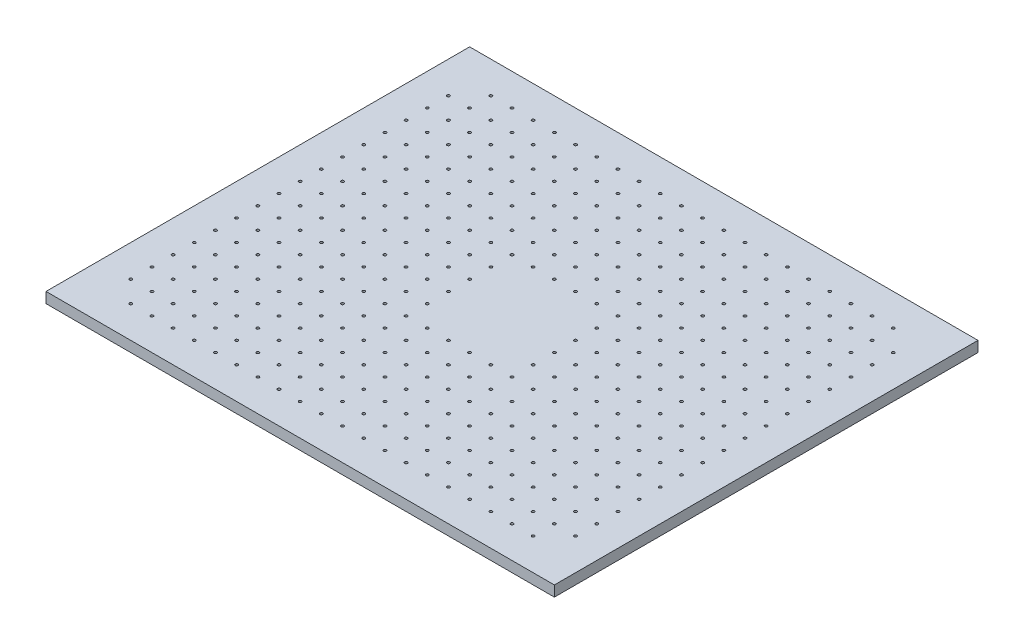
from build123d import *

# Parameters (mm, degrees)
CROQUIS_TABLERO_W                   = 1200
CROQUIS_TABLERO_H                   = 1000
TABLERO_1200X1000X25_DEPTH          = 25
REJILLA_AGUJEROS_M6_D6_6_DEPTH      = 782.424980404
REJILLA_AGUJEROS_M6_D6_6_DEPTH_BACK = 782.424980404
CROQUIS_REJILLA_M6_PASO50_R         = 3.3


with BuildPart() as part:
    # Croquis_tablero → Tablero_1200x1000x25 (new body)
    with BuildSketch(Plane(origin=(0, 0, 0), x_dir=(1, 0, 0), z_dir=(0, 1, 0))):
        Rectangle(CROQUIS_TABLERO_W, CROQUIS_TABLERO_H)
    extrude(amount=-TABLERO_1200X1000X25_DEPTH)

    # Croquis_rejilla_M6_paso50 → Rejilla_agujeros_M6_D6.6 (cut, two sides: drawn at the far end of the back side and taken through both)
    with BuildSketch(Plane(origin=(0, 0, 0), x_dir=(1, 0, 0), z_dir=(0, 1, 0)).offset(-REJILLA_AGUJEROS_M6_D6_6_DEPTH_BACK)):
        with Locations(Location((-525, -375, 0), (0, 0, 270))):
            Circle(CROQUIS_REJILLA_M6_PASO50_R)
        with Locations(Location((-525, -325, 0), (0, 0, 270))):
            Circle(CROQUIS_REJILLA_M6_PASO50_R)
        with Locations(Location((-525, -275, 0), (0, 0, 270))):
            Circle(CROQUIS_REJILLA_M6_PASO50_R)
        with Locations(Location((-525, -225, 0), (0, 0, 270))):
            Circle(CROQUIS_REJILLA_M6_PASO50_R)
        with Locations(Location((-525, -175, 0), (0, 0, 270))):
            Circle(CROQUIS_REJILLA_M6_PASO50_R)
        with Locations(Location((-525, -125, 0), (0, 0, 270))):
            Circle(CROQUIS_REJILLA_M6_PASO50_R)
        with Locations(Location((-525, -75, 0), (0, 0, 270))):
            Circle(CROQUIS_REJILLA_M6_PASO50_R)
        with Locations(Location((-525, -25, 0), (0, 0, 270))):
            Circle(CROQUIS_REJILLA_M6_PASO50_R)
        with Locations(Location((-525, 25, 0), (0, 0, 270))):
            Circle(CROQUIS_REJILLA_M6_PASO50_R)
        with Locations(Location((-525, 75, 0), (0, 0, 270))):
            Circle(CROQUIS_REJILLA_M6_PASO50_R)
        with Locations(Location((-525, 125, 0), (0, 0, 270))):
            Circle(CROQUIS_REJILLA_M6_PASO50_R)
        with Locations(Location((-525, 175, 0), (0, 0, 270))):
            Circle(CROQUIS_REJILLA_M6_PASO50_R)
        with Locations(Location((-525, 225, 0), (0, 0, 270))):
            Circle(CROQUIS_REJILLA_M6_PASO50_R)
        with Locations(Location((-525, 275, 0), (0, 0, 270))):
            Circle(CROQUIS_REJILLA_M6_PASO50_R)
        with Locations(Location((-525, 325, 0), (0, 0, 270))):
            Circle(CROQUIS_REJILLA_M6_PASO50_R)
        with Locations(Location((-525, 375, 0), (0, 0, 270))):
            Circle(CROQUIS_REJILLA_M6_PASO50_R)
        with Locations(Location((-475, -425, 0), (0, 0, 270))):
            Circle(CROQUIS_REJILLA_M6_PASO50_R)
        with Locations(Location((-475, -375, 0), (0, 0, 270))):
            Circle(CROQUIS_REJILLA_M6_PASO50_R)
        with Locations(Location((-475, -325, 0), (0, 0, 270))):
            Circle(CROQUIS_REJILLA_M6_PASO50_R)
        with Locations(Location((-475, -275, 0), (0, 0, 270))):
            Circle(CROQUIS_REJILLA_M6_PASO50_R)
        with Locations(Location((-475, -225, 0), (0, 0, 270))):
            Circle(CROQUIS_REJILLA_M6_PASO50_R)
        with Locations(Location((-475, -175, 0), (0, 0, 270))):
            Circle(CROQUIS_REJILLA_M6_PASO50_R)
        with Locations(Location((-475, -125, 0), (0, 0, 270))):
            Circle(CROQUIS_REJILLA_M6_PASO50_R)
        with Locations(Location((-475, -75, 0), (0, 0, 270))):
            Circle(CROQUIS_REJILLA_M6_PASO50_R)
        with Locations(Location((-475, -25, 0), (0, 0, 270))):
            Circle(CROQUIS_REJILLA_M6_PASO50_R)
        with Locations(Location((-475, 25, 0), (0, 0, 270))):
            Circle(CROQUIS_REJILLA_M6_PASO50_R)
        with Locations(Location((-475, 75, 0), (0, 0, 270))):
            Circle(CROQUIS_REJILLA_M6_PASO50_R)
        with Locations(Location((-475, 125, 0), (0, 0, 270))):
            Circle(CROQUIS_REJILLA_M6_PASO50_R)
        with Locations(Location((-475, 175, 0), (0, 0, 270))):
            Circle(CROQUIS_REJILLA_M6_PASO50_R)
        with Locations(Location((-475, 225, 0), (0, 0, 270))):
            Circle(CROQUIS_REJILLA_M6_PASO50_R)
        with Locations(Location((-475, 275, 0), (0, 0, 270))):
            Circle(CROQUIS_REJILLA_M6_PASO50_R)
        with Locations(Location((-475, 325, 0), (0, 0, 270))):
            Circle(CROQUIS_REJILLA_M6_PASO50_R)
        with Locations(Location((-475, 375, 0), (0, 0, 270))):
            Circle(CROQUIS_REJILLA_M6_PASO50_R)
        with Locations(Location((-475, 425, 0), (0, 0, 270))):
            Circle(CROQUIS_REJILLA_M6_PASO50_R)
        with Locations(Location((-425, -425, 0), (0, 0, 270))):
            Circle(CROQUIS_REJILLA_M6_PASO50_R)
        with Locations(Location((-425, -375, 0), (0, 0, 270))):
            Circle(CROQUIS_REJILLA_M6_PASO50_R)
        with Locations(Location((-425, -325, 0), (0, 0, 270))):
            Circle(CROQUIS_REJILLA_M6_PASO50_R)
        with Locations(Location((-425, -275, 0), (0, 0, 270))):
            Circle(CROQUIS_REJILLA_M6_PASO50_R)
        with Locations(Location((-425, -225, 0), (0, 0, 270))):
            Circle(CROQUIS_REJILLA_M6_PASO50_R)
        with Locations(Location((-425, -175, 0), (0, 0, 270))):
            Circle(CROQUIS_REJILLA_M6_PASO50_R)
        with Locations(Location((-425, -125, 0), (0, 0, 270))):
            Circle(CROQUIS_REJILLA_M6_PASO50_R)
        with Locations(Location((-425, -75, 0), (0, 0, 270))):
            Circle(CROQUIS_REJILLA_M6_PASO50_R)
        with Locations(Location((-425, -25, 0), (0, 0, 270))):
            Circle(CROQUIS_REJILLA_M6_PASO50_R)
        with Locations(Location((-425, 25, 0), (0, 0, 270))):
            Circle(CROQUIS_REJILLA_M6_PASO50_R)
        with Locations(Location((-425, 75, 0), (0, 0, 270))):
            Circle(CROQUIS_REJILLA_M6_PASO50_R)
        with Locations(Location((-425, 125, 0), (0, 0, 270))):
            Circle(CROQUIS_REJILLA_M6_PASO50_R)
        with Locations(Location((-425, 175, 0), (0, 0, 270))):
            Circle(CROQUIS_REJILLA_M6_PASO50_R)
        with Locations(Location((-425, 225, 0), (0, 0, 270))):
            Circle(CROQUIS_REJILLA_M6_PASO50_R)
        with Locations(Location((-425, 275, 0), (0, 0, 270))):
            Circle(CROQUIS_REJILLA_M6_PASO50_R)
        with Locations(Location((-425, 325, 0), (0, 0, 270))):
            Circle(CROQUIS_REJILLA_M6_PASO50_R)
        with Locations(Location((-425, 375, 0), (0, 0, 270))):
            Circle(CROQUIS_REJILLA_M6_PASO50_R)
        with Locations(Location((-425, 425, 0), (0, 0, 270))):
            Circle(CROQUIS_REJILLA_M6_PASO50_R)
        with Locations(Location((-375, -425, 0), (0, 0, 270))):
            Circle(CROQUIS_REJILLA_M6_PASO50_R)
        with Locations(Location((-375, -375, 0), (0, 0, 270))):
            Circle(CROQUIS_REJILLA_M6_PASO50_R)
        with Locations(Location((-375, -325, 0), (0, 0, 270))):
            Circle(CROQUIS_REJILLA_M6_PASO50_R)
        with Locations(Location((-375, -275, 0), (0, 0, 270))):
            Circle(CROQUIS_REJILLA_M6_PASO50_R)
        with Locations(Location((-375, -225, 0), (0, 0, 270))):
            Circle(CROQUIS_REJILLA_M6_PASO50_R)
        with Locations(Location((-375, -175, 0), (0, 0, 270))):
            Circle(CROQUIS_REJILLA_M6_PASO50_R)
        with Locations(Location((-375, -125, 0), (0, 0, 270))):
            Circle(CROQUIS_REJILLA_M6_PASO50_R)
        with Locations(Location((-375, -75, 0), (0, 0, 270))):
            Circle(CROQUIS_REJILLA_M6_PASO50_R)
        with Locations(Location((-375, -25, 0), (0, 0, 270))):
            Circle(CROQUIS_REJILLA_M6_PASO50_R)
        with Locations(Location((-375, 25, 0), (0, 0, 270))):
            Circle(CROQUIS_REJILLA_M6_PASO50_R)
        with Locations(Location((-375, 75, 0), (0, 0, 270))):
            Circle(CROQUIS_REJILLA_M6_PASO50_R)
        with Locations(Location((-375, 125, 0), (0, 0, 270))):
            Circle(CROQUIS_REJILLA_M6_PASO50_R)
        with Locations(Location((-375, 175, 0), (0, 0, 270))):
            Circle(CROQUIS_REJILLA_M6_PASO50_R)
        with Locations(Location((-375, 225, 0), (0, 0, 270))):
            Circle(CROQUIS_REJILLA_M6_PASO50_R)
        with Locations(Location((-375, 275, 0), (0, 0, 270))):
            Circle(CROQUIS_REJILLA_M6_PASO50_R)
        with Locations(Location((-375, 325, 0), (0, 0, 270))):
            Circle(CROQUIS_REJILLA_M6_PASO50_R)
        with Locations(Location((-375, 375, 0), (0, 0, 270))):
            Circle(CROQUIS_REJILLA_M6_PASO50_R)
        with Locations(Location((-375, 425, 0), (0, 0, 270))):
            Circle(CROQUIS_REJILLA_M6_PASO50_R)
        with Locations(Location((-325, -425, 0), (0, 0, 270))):
            Circle(CROQUIS_REJILLA_M6_PASO50_R)
        with Locations(Location((-325, -375, 0), (0, 0, 270))):
            Circle(CROQUIS_REJILLA_M6_PASO50_R)
        with Locations(Location((-325, -325, 0), (0, 0, 270))):
            Circle(CROQUIS_REJILLA_M6_PASO50_R)
        with Locations(Location((-325, -275, 0), (0, 0, 270))):
            Circle(CROQUIS_REJILLA_M6_PASO50_R)
        with Locations(Location((-325, -225, 0), (0, 0, 270))):
            Circle(CROQUIS_REJILLA_M6_PASO50_R)
        with Locations(Location((-325, -175, 0), (0, 0, 270))):
            Circle(CROQUIS_REJILLA_M6_PASO50_R)
        with Locations(Location((-325, -125, 0), (0, 0, 270))):
            Circle(CROQUIS_REJILLA_M6_PASO50_R)
        with Locations(Location((-325, -75, 0), (0, 0, 270))):
            Circle(CROQUIS_REJILLA_M6_PASO50_R)
        with Locations(Location((-325, -25, 0), (0, 0, 270))):
            Circle(CROQUIS_REJILLA_M6_PASO50_R)
        with Locations(Location((-325, 25, 0), (0, 0, 270))):
            Circle(CROQUIS_REJILLA_M6_PASO50_R)
        with Locations(Location((-325, 75, 0), (0, 0, 270))):
            Circle(CROQUIS_REJILLA_M6_PASO50_R)
        with Locations(Location((-325, 125, 0), (0, 0, 270))):
            Circle(CROQUIS_REJILLA_M6_PASO50_R)
        with Locations(Location((-325, 175, 0), (0, 0, 270))):
            Circle(CROQUIS_REJILLA_M6_PASO50_R)
        with Locations(Location((-325, 225, 0), (0, 0, 270))):
            Circle(CROQUIS_REJILLA_M6_PASO50_R)
        with Locations(Location((-325, 275, 0), (0, 0, 270))):
            Circle(CROQUIS_REJILLA_M6_PASO50_R)
        with Locations(Location((-325, 325, 0), (0, 0, 270))):
            Circle(CROQUIS_REJILLA_M6_PASO50_R)
        with Locations(Location((-325, 375, 0), (0, 0, 270))):
            Circle(CROQUIS_REJILLA_M6_PASO50_R)
        with Locations(Location((-325, 425, 0), (0, 0, 270))):
            Circle(CROQUIS_REJILLA_M6_PASO50_R)
        with Locations(Location((-275, -425, 0), (0, 0, 270))):
            Circle(CROQUIS_REJILLA_M6_PASO50_R)
        with Locations(Location((-275, -375, 0), (0, 0, 270))):
            Circle(CROQUIS_REJILLA_M6_PASO50_R)
        with Locations(Location((-275, -325, 0), (0, 0, 270))):
            Circle(CROQUIS_REJILLA_M6_PASO50_R)
        with Locations(Location((-275, -275, 0), (0, 0, 270))):
            Circle(CROQUIS_REJILLA_M6_PASO50_R)
        with Locations(Location((-275, -225, 0), (0, 0, 270))):
            Circle(CROQUIS_REJILLA_M6_PASO50_R)
        with Locations(Location((-275, -175, 0), (0, 0, 270))):
            Circle(CROQUIS_REJILLA_M6_PASO50_R)
        with Locations(Location((-275, -125, 0), (0, 0, 270))):
            Circle(CROQUIS_REJILLA_M6_PASO50_R)
        with Locations(Location((-275, -75, 0), (0, 0, 270))):
            Circle(CROQUIS_REJILLA_M6_PASO50_R)
        with Locations(Location((-275, -25, 0), (0, 0, 270))):
            Circle(CROQUIS_REJILLA_M6_PASO50_R)
        with Locations(Location((-275, 25, 0), (0, 0, 270))):
            Circle(CROQUIS_REJILLA_M6_PASO50_R)
        with Locations(Location((-275, 75, 0), (0, 0, 270))):
            Circle(CROQUIS_REJILLA_M6_PASO50_R)
        with Locations(Location((-275, 125, 0), (0, 0, 270))):
            Circle(CROQUIS_REJILLA_M6_PASO50_R)
        with Locations(Location((-275, 175, 0), (0, 0, 270))):
            Circle(CROQUIS_REJILLA_M6_PASO50_R)
        with Locations(Location((-275, 225, 0), (0, 0, 270))):
            Circle(CROQUIS_REJILLA_M6_PASO50_R)
        with Locations(Location((-275, 275, 0), (0, 0, 270))):
            Circle(CROQUIS_REJILLA_M6_PASO50_R)
        with Locations(Location((-275, 325, 0), (0, 0, 270))):
            Circle(CROQUIS_REJILLA_M6_PASO50_R)
        with Locations(Location((-275, 375, 0), (0, 0, 270))):
            Circle(CROQUIS_REJILLA_M6_PASO50_R)
        with Locations(Location((-275, 425, 0), (0, 0, 270))):
            Circle(CROQUIS_REJILLA_M6_PASO50_R)
        with Locations(Location((-225, -425, 0), (0, 0, 270))):
            Circle(CROQUIS_REJILLA_M6_PASO50_R)
        with Locations(Location((-225, -375, 0), (0, 0, 270))):
            Circle(CROQUIS_REJILLA_M6_PASO50_R)
        with Locations(Location((-225, -325, 0), (0, 0, 270))):
            Circle(CROQUIS_REJILLA_M6_PASO50_R)
        with Locations(Location((-225, -275, 0), (0, 0, 270))):
            Circle(CROQUIS_REJILLA_M6_PASO50_R)
        with Locations(Location((-225, -225, 0), (0, 0, 270))):
            Circle(CROQUIS_REJILLA_M6_PASO50_R)
        with Locations(Location((-225, -175, 0), (0, 0, 270))):
            Circle(CROQUIS_REJILLA_M6_PASO50_R)
        with Locations(Location((-225, -125, 0), (0, 0, 270))):
            Circle(CROQUIS_REJILLA_M6_PASO50_R)
        with Locations(Location((-225, -75, 0), (0, 0, 270))):
            Circle(CROQUIS_REJILLA_M6_PASO50_R)
        with Locations(Location((-225, -25, 0), (0, 0, 270))):
            Circle(CROQUIS_REJILLA_M6_PASO50_R)
        with Locations(Location((-225, 25, 0), (0, 0, 270))):
            Circle(CROQUIS_REJILLA_M6_PASO50_R)
        with Locations(Location((-225, 75, 0), (0, 0, 270))):
            Circle(CROQUIS_REJILLA_M6_PASO50_R)
        with Locations(Location((-225, 125, 0), (0, 0, 270))):
            Circle(CROQUIS_REJILLA_M6_PASO50_R)
        with Locations(Location((-225, 175, 0), (0, 0, 270))):
            Circle(CROQUIS_REJILLA_M6_PASO50_R)
        with Locations(Location((-225, 225, 0), (0, 0, 270))):
            Circle(CROQUIS_REJILLA_M6_PASO50_R)
        with Locations(Location((-225, 275, 0), (0, 0, 270))):
            Circle(CROQUIS_REJILLA_M6_PASO50_R)
        with Locations(Location((-225, 325, 0), (0, 0, 270))):
            Circle(CROQUIS_REJILLA_M6_PASO50_R)
        with Locations(Location((-225, 375, 0), (0, 0, 270))):
            Circle(CROQUIS_REJILLA_M6_PASO50_R)
        with Locations(Location((-225, 425, 0), (0, 0, 270))):
            Circle(CROQUIS_REJILLA_M6_PASO50_R)
        with Locations(Location((-175, -425, 0), (0, 0, 270))):
            Circle(CROQUIS_REJILLA_M6_PASO50_R)
        with Locations(Location((-175, -375, 0), (0, 0, 270))):
            Circle(CROQUIS_REJILLA_M6_PASO50_R)
        with Locations(Location((-175, -325, 0), (0, 0, 270))):
            Circle(CROQUIS_REJILLA_M6_PASO50_R)
        with Locations(Location((-175, -275, 0), (0, 0, 270))):
            Circle(CROQUIS_REJILLA_M6_PASO50_R)
        with Locations(Location((-175, -225, 0), (0, 0, 270))):
            Circle(CROQUIS_REJILLA_M6_PASO50_R)
        with Locations(Location((-175, -175, 0), (0, 0, 270))):
            Circle(CROQUIS_REJILLA_M6_PASO50_R)
        with Locations(Location((-175, -125, 0), (0, 0, 270))):
            Circle(CROQUIS_REJILLA_M6_PASO50_R)
        with Locations(Location((-175, -75, 0), (0, 0, 270))):
            Circle(CROQUIS_REJILLA_M6_PASO50_R)
        with Locations(Location((-175, -25, 0), (0, 0, 270))):
            Circle(CROQUIS_REJILLA_M6_PASO50_R)
        with Locations(Location((-175, 25, 0), (0, 0, 270))):
            Circle(CROQUIS_REJILLA_M6_PASO50_R)
        with Locations(Location((-175, 75, 0), (0, 0, 270))):
            Circle(CROQUIS_REJILLA_M6_PASO50_R)
        with Locations(Location((-175, 125, 0), (0, 0, 270))):
            Circle(CROQUIS_REJILLA_M6_PASO50_R)
        with Locations(Location((-175, 175, 0), (0, 0, 270))):
            Circle(CROQUIS_REJILLA_M6_PASO50_R)
        with Locations(Location((-175, 225, 0), (0, 0, 270))):
            Circle(CROQUIS_REJILLA_M6_PASO50_R)
        with Locations(Location((-175, 275, 0), (0, 0, 270))):
            Circle(CROQUIS_REJILLA_M6_PASO50_R)
        with Locations(Location((-175, 325, 0), (0, 0, 270))):
            Circle(CROQUIS_REJILLA_M6_PASO50_R)
        with Locations(Location((-175, 375, 0), (0, 0, 270))):
            Circle(CROQUIS_REJILLA_M6_PASO50_R)
        with Locations(Location((-175, 425, 0), (0, 0, 270))):
            Circle(CROQUIS_REJILLA_M6_PASO50_R)
        with Locations(Location((-125, -425, 0), (0, 0, 270))):
            Circle(CROQUIS_REJILLA_M6_PASO50_R)
        with Locations(Location((-125, -375, 0), (0, 0, 270))):
            Circle(CROQUIS_REJILLA_M6_PASO50_R)
        with Locations(Location((-125, -325, 0), (0, 0, 270))):
            Circle(CROQUIS_REJILLA_M6_PASO50_R)
        with Locations(Location((-125, -275, 0), (0, 0, 270))):
            Circle(CROQUIS_REJILLA_M6_PASO50_R)
        with Locations(Location((-125, -225, 0), (0, 0, 270))):
            Circle(CROQUIS_REJILLA_M6_PASO50_R)
        with Locations(Location((-125, -175, 0), (0, 0, 270))):
            Circle(CROQUIS_REJILLA_M6_PASO50_R)
        with Locations(Location((-125, -125, 0), (0, 0, 270))):
            Circle(CROQUIS_REJILLA_M6_PASO50_R)
        with Locations(Location((-125, -75, 0), (0, 0, 270))):
            Circle(CROQUIS_REJILLA_M6_PASO50_R)
        with Locations(Location((-125, -25, 0), (0, 0, 270))):
            Circle(CROQUIS_REJILLA_M6_PASO50_R)
        with Locations(Location((-125, 25, 0), (0, 0, 270))):
            Circle(CROQUIS_REJILLA_M6_PASO50_R)
        with Locations(Location((-125, 75, 0), (0, 0, 270))):
            Circle(CROQUIS_REJILLA_M6_PASO50_R)
        with Locations(Location((-125, 125, 0), (0, 0, 270))):
            Circle(CROQUIS_REJILLA_M6_PASO50_R)
        with Locations(Location((-125, 175, 0), (0, 0, 270))):
            Circle(CROQUIS_REJILLA_M6_PASO50_R)
        with Locations(Location((-125, 225, 0), (0, 0, 270))):
            Circle(CROQUIS_REJILLA_M6_PASO50_R)
        with Locations(Location((-125, 275, 0), (0, 0, 270))):
            Circle(CROQUIS_REJILLA_M6_PASO50_R)
        with Locations(Location((-125, 325, 0), (0, 0, 270))):
            Circle(CROQUIS_REJILLA_M6_PASO50_R)
        with Locations(Location((-125, 375, 0), (0, 0, 270))):
            Circle(CROQUIS_REJILLA_M6_PASO50_R)
        with Locations(Location((-125, 425, 0), (0, 0, 270))):
            Circle(CROQUIS_REJILLA_M6_PASO50_R)
        with Locations(Location((-75, -425, 0), (0, 0, 270))):
            Circle(CROQUIS_REJILLA_M6_PASO50_R)
        with Locations(Location((-75, -375, 0), (0, 0, 270))):
            Circle(CROQUIS_REJILLA_M6_PASO50_R)
        with Locations(Location((-75, -325, 0), (0, 0, 270))):
            Circle(CROQUIS_REJILLA_M6_PASO50_R)
        with Locations(Location((-75, -275, 0), (0, 0, 270))):
            Circle(CROQUIS_REJILLA_M6_PASO50_R)
        with Locations(Location((-75, -225, 0), (0, 0, 270))):
            Circle(CROQUIS_REJILLA_M6_PASO50_R)
        with Locations(Location((-75, -175, 0), (0, 0, 270))):
            Circle(CROQUIS_REJILLA_M6_PASO50_R)
        with Locations(Location((-75, -125, 0), (0, 0, 270))):
            Circle(CROQUIS_REJILLA_M6_PASO50_R)
        with Locations(Location((-75, 125, 0), (0, 0, 270))):
            Circle(CROQUIS_REJILLA_M6_PASO50_R)
        with Locations(Location((-75, 175, 0), (0, 0, 270))):
            Circle(CROQUIS_REJILLA_M6_PASO50_R)
        with Locations(Location((-75, 225, 0), (0, 0, 270))):
            Circle(CROQUIS_REJILLA_M6_PASO50_R)
        with Locations(Location((-75, 275, 0), (0, 0, 270))):
            Circle(CROQUIS_REJILLA_M6_PASO50_R)
        with Locations(Location((-75, 325, 0), (0, 0, 270))):
            Circle(CROQUIS_REJILLA_M6_PASO50_R)
        with Locations(Location((-75, 375, 0), (0, 0, 270))):
            Circle(CROQUIS_REJILLA_M6_PASO50_R)
        with Locations(Location((-75, 425, 0), (0, 0, 270))):
            Circle(CROQUIS_REJILLA_M6_PASO50_R)
        with Locations(Location((-25, -425, 0), (0, 0, 270))):
            Circle(CROQUIS_REJILLA_M6_PASO50_R)
        with Locations(Location((-25, -375, 0), (0, 0, 270))):
            Circle(CROQUIS_REJILLA_M6_PASO50_R)
        with Locations(Location((-25, -325, 0), (0, 0, 270))):
            Circle(CROQUIS_REJILLA_M6_PASO50_R)
        with Locations(Location((-25, -275, 0), (0, 0, 270))):
            Circle(CROQUIS_REJILLA_M6_PASO50_R)
        with Locations(Location((-25, -225, 0), (0, 0, 270))):
            Circle(CROQUIS_REJILLA_M6_PASO50_R)
        with Locations(Location((-25, -175, 0), (0, 0, 270))):
            Circle(CROQUIS_REJILLA_M6_PASO50_R)
        with Locations(Location((-25, -125, 0), (0, 0, 270))):
            Circle(CROQUIS_REJILLA_M6_PASO50_R)
        with Locations(Location((-25, 125, 0), (0, 0, 270))):
            Circle(CROQUIS_REJILLA_M6_PASO50_R)
        with Locations(Location((-25, 175, 0), (0, 0, 270))):
            Circle(CROQUIS_REJILLA_M6_PASO50_R)
        with Locations(Location((-25, 225, 0), (0, 0, 270))):
            Circle(CROQUIS_REJILLA_M6_PASO50_R)
        with Locations(Location((-25, 275, 0), (0, 0, 270))):
            Circle(CROQUIS_REJILLA_M6_PASO50_R)
        with Locations(Location((-25, 325, 0), (0, 0, 270))):
            Circle(CROQUIS_REJILLA_M6_PASO50_R)
        with Locations(Location((-25, 375, 0), (0, 0, 270))):
            Circle(CROQUIS_REJILLA_M6_PASO50_R)
        with Locations(Location((-25, 425, 0), (0, 0, 270))):
            Circle(CROQUIS_REJILLA_M6_PASO50_R)
        with Locations(Location((25, -425, 0), (0, 0, 270))):
            Circle(CROQUIS_REJILLA_M6_PASO50_R)
        with Locations(Location((25, -375, 0), (0, 0, 270))):
            Circle(CROQUIS_REJILLA_M6_PASO50_R)
        with Locations(Location((25, -325, 0), (0, 0, 270))):
            Circle(CROQUIS_REJILLA_M6_PASO50_R)
        with Locations(Location((25, -275, 0), (0, 0, 270))):
            Circle(CROQUIS_REJILLA_M6_PASO50_R)
        with Locations(Location((25, -225, 0), (0, 0, 270))):
            Circle(CROQUIS_REJILLA_M6_PASO50_R)
        with Locations(Location((25, -175, 0), (0, 0, 270))):
            Circle(CROQUIS_REJILLA_M6_PASO50_R)
        with Locations(Location((25, -125, 0), (0, 0, 270))):
            Circle(CROQUIS_REJILLA_M6_PASO50_R)
        with Locations(Location((25, 125, 0), (0, 0, 270))):
            Circle(CROQUIS_REJILLA_M6_PASO50_R)
        with Locations(Location((25, 175, 0), (0, 0, 270))):
            Circle(CROQUIS_REJILLA_M6_PASO50_R)
        with Locations(Location((25, 225, 0), (0, 0, 270))):
            Circle(CROQUIS_REJILLA_M6_PASO50_R)
        with Locations(Location((25, 275, 0), (0, 0, 270))):
            Circle(CROQUIS_REJILLA_M6_PASO50_R)
        with Locations(Location((25, 325, 0), (0, 0, 270))):
            Circle(CROQUIS_REJILLA_M6_PASO50_R)
        with Locations(Location((25, 375, 0), (0, 0, 270))):
            Circle(CROQUIS_REJILLA_M6_PASO50_R)
        with Locations(Location((25, 425, 0), (0, 0, 270))):
            Circle(CROQUIS_REJILLA_M6_PASO50_R)
        with Locations(Location((75, -425, 0), (0, 0, 270))):
            Circle(CROQUIS_REJILLA_M6_PASO50_R)
        with Locations(Location((75, -375, 0), (0, 0, 270))):
            Circle(CROQUIS_REJILLA_M6_PASO50_R)
        with Locations(Location((75, -325, 0), (0, 0, 270))):
            Circle(CROQUIS_REJILLA_M6_PASO50_R)
        with Locations(Location((75, -275, 0), (0, 0, 270))):
            Circle(CROQUIS_REJILLA_M6_PASO50_R)
        with Locations(Location((75, -225, 0), (0, 0, 270))):
            Circle(CROQUIS_REJILLA_M6_PASO50_R)
        with Locations(Location((75, -175, 0), (0, 0, 270))):
            Circle(CROQUIS_REJILLA_M6_PASO50_R)
        with Locations(Location((75, -125, 0), (0, 0, 270))):
            Circle(CROQUIS_REJILLA_M6_PASO50_R)
        with Locations(Location((75, 125, 0), (0, 0, 270))):
            Circle(CROQUIS_REJILLA_M6_PASO50_R)
        with Locations(Location((75, 175, 0), (0, 0, 270))):
            Circle(CROQUIS_REJILLA_M6_PASO50_R)
        with Locations(Location((75, 225, 0), (0, 0, 270))):
            Circle(CROQUIS_REJILLA_M6_PASO50_R)
        with Locations(Location((75, 275, 0), (0, 0, 270))):
            Circle(CROQUIS_REJILLA_M6_PASO50_R)
        with Locations(Location((75, 325, 0), (0, 0, 270))):
            Circle(CROQUIS_REJILLA_M6_PASO50_R)
        with Locations(Location((75, 375, 0), (0, 0, 270))):
            Circle(CROQUIS_REJILLA_M6_PASO50_R)
        with Locations(Location((75, 425, 0), (0, 0, 270))):
            Circle(CROQUIS_REJILLA_M6_PASO50_R)
        with Locations(Location((125, -425, 0), (0, 0, 270))):
            Circle(CROQUIS_REJILLA_M6_PASO50_R)
        with Locations(Location((125, -375, 0), (0, 0, 270))):
            Circle(CROQUIS_REJILLA_M6_PASO50_R)
        with Locations(Location((125, -325, 0), (0, 0, 270))):
            Circle(CROQUIS_REJILLA_M6_PASO50_R)
        with Locations(Location((125, -275, 0), (0, 0, 270))):
            Circle(CROQUIS_REJILLA_M6_PASO50_R)
        with Locations(Location((125, -225, 0), (0, 0, 270))):
            Circle(CROQUIS_REJILLA_M6_PASO50_R)
        with Locations(Location((125, -175, 0), (0, 0, 270))):
            Circle(CROQUIS_REJILLA_M6_PASO50_R)
        with Locations(Location((125, -125, 0), (0, 0, 270))):
            Circle(CROQUIS_REJILLA_M6_PASO50_R)
        with Locations(Location((125, -75, 0), (0, 0, 270))):
            Circle(CROQUIS_REJILLA_M6_PASO50_R)
        with Locations(Location((125, -25, 0), (0, 0, 270))):
            Circle(CROQUIS_REJILLA_M6_PASO50_R)
        with Locations(Location((125, 25, 0), (0, 0, 270))):
            Circle(CROQUIS_REJILLA_M6_PASO50_R)
        with Locations(Location((125, 75, 0), (0, 0, 270))):
            Circle(CROQUIS_REJILLA_M6_PASO50_R)
        with Locations(Location((125, 125, 0), (0, 0, 270))):
            Circle(CROQUIS_REJILLA_M6_PASO50_R)
        with Locations(Location((125, 175, 0), (0, 0, 270))):
            Circle(CROQUIS_REJILLA_M6_PASO50_R)
        with Locations(Location((125, 225, 0), (0, 0, 270))):
            Circle(CROQUIS_REJILLA_M6_PASO50_R)
        with Locations(Location((125, 275, 0), (0, 0, 270))):
            Circle(CROQUIS_REJILLA_M6_PASO50_R)
        with Locations(Location((125, 325, 0), (0, 0, 270))):
            Circle(CROQUIS_REJILLA_M6_PASO50_R)
        with Locations(Location((125, 375, 0), (0, 0, 270))):
            Circle(CROQUIS_REJILLA_M6_PASO50_R)
        with Locations(Location((125, 425, 0), (0, 0, 270))):
            Circle(CROQUIS_REJILLA_M6_PASO50_R)
        with Locations(Location((175, -425, 0), (0, 0, 270))):
            Circle(CROQUIS_REJILLA_M6_PASO50_R)
        with Locations(Location((175, -375, 0), (0, 0, 270))):
            Circle(CROQUIS_REJILLA_M6_PASO50_R)
        with Locations(Location((175, -325, 0), (0, 0, 270))):
            Circle(CROQUIS_REJILLA_M6_PASO50_R)
        with Locations(Location((175, -275, 0), (0, 0, 270))):
            Circle(CROQUIS_REJILLA_M6_PASO50_R)
        with Locations(Location((175, -225, 0), (0, 0, 270))):
            Circle(CROQUIS_REJILLA_M6_PASO50_R)
        with Locations(Location((175, -175, 0), (0, 0, 270))):
            Circle(CROQUIS_REJILLA_M6_PASO50_R)
        with Locations(Location((175, -125, 0), (0, 0, 270))):
            Circle(CROQUIS_REJILLA_M6_PASO50_R)
        with Locations(Location((175, -75, 0), (0, 0, 270))):
            Circle(CROQUIS_REJILLA_M6_PASO50_R)
        with Locations(Location((175, -25, 0), (0, 0, 270))):
            Circle(CROQUIS_REJILLA_M6_PASO50_R)
        with Locations(Location((175, 25, 0), (0, 0, 270))):
            Circle(CROQUIS_REJILLA_M6_PASO50_R)
        with Locations(Location((175, 75, 0), (0, 0, 270))):
            Circle(CROQUIS_REJILLA_M6_PASO50_R)
        with Locations(Location((175, 125, 0), (0, 0, 270))):
            Circle(CROQUIS_REJILLA_M6_PASO50_R)
        with Locations(Location((175, 175, 0), (0, 0, 270))):
            Circle(CROQUIS_REJILLA_M6_PASO50_R)
        with Locations(Location((175, 225, 0), (0, 0, 270))):
            Circle(CROQUIS_REJILLA_M6_PASO50_R)
        with Locations(Location((175, 275, 0), (0, 0, 270))):
            Circle(CROQUIS_REJILLA_M6_PASO50_R)
        with Locations(Location((175, 325, 0), (0, 0, 270))):
            Circle(CROQUIS_REJILLA_M6_PASO50_R)
        with Locations(Location((175, 375, 0), (0, 0, 270))):
            Circle(CROQUIS_REJILLA_M6_PASO50_R)
        with Locations(Location((175, 425, 0), (0, 0, 270))):
            Circle(CROQUIS_REJILLA_M6_PASO50_R)
        with Locations(Location((225, -425, 0), (0, 0, 270))):
            Circle(CROQUIS_REJILLA_M6_PASO50_R)
        with Locations(Location((225, -375, 0), (0, 0, 270))):
            Circle(CROQUIS_REJILLA_M6_PASO50_R)
        with Locations(Location((225, -325, 0), (0, 0, 270))):
            Circle(CROQUIS_REJILLA_M6_PASO50_R)
        with Locations(Location((225, -275, 0), (0, 0, 270))):
            Circle(CROQUIS_REJILLA_M6_PASO50_R)
        with Locations(Location((225, -225, 0), (0, 0, 270))):
            Circle(CROQUIS_REJILLA_M6_PASO50_R)
        with Locations(Location((225, -175, 0), (0, 0, 270))):
            Circle(CROQUIS_REJILLA_M6_PASO50_R)
        with Locations(Location((225, -125, 0), (0, 0, 270))):
            Circle(CROQUIS_REJILLA_M6_PASO50_R)
        with Locations(Location((225, -75, 0), (0, 0, 270))):
            Circle(CROQUIS_REJILLA_M6_PASO50_R)
        with Locations(Location((225, -25, 0), (0, 0, 270))):
            Circle(CROQUIS_REJILLA_M6_PASO50_R)
        with Locations(Location((225, 25, 0), (0, 0, 270))):
            Circle(CROQUIS_REJILLA_M6_PASO50_R)
        with Locations(Location((225, 75, 0), (0, 0, 270))):
            Circle(CROQUIS_REJILLA_M6_PASO50_R)
        with Locations(Location((225, 125, 0), (0, 0, 270))):
            Circle(CROQUIS_REJILLA_M6_PASO50_R)
        with Locations(Location((225, 175, 0), (0, 0, 270))):
            Circle(CROQUIS_REJILLA_M6_PASO50_R)
        with Locations(Location((225, 225, 0), (0, 0, 270))):
            Circle(CROQUIS_REJILLA_M6_PASO50_R)
        with Locations(Location((225, 275, 0), (0, 0, 270))):
            Circle(CROQUIS_REJILLA_M6_PASO50_R)
        with Locations(Location((225, 325, 0), (0, 0, 270))):
            Circle(CROQUIS_REJILLA_M6_PASO50_R)
        with Locations(Location((225, 375, 0), (0, 0, 270))):
            Circle(CROQUIS_REJILLA_M6_PASO50_R)
        with Locations(Location((225, 425, 0), (0, 0, 270))):
            Circle(CROQUIS_REJILLA_M6_PASO50_R)
        with Locations(Location((275, -425, 0), (0, 0, 270))):
            Circle(CROQUIS_REJILLA_M6_PASO50_R)
        with Locations(Location((275, -375, 0), (0, 0, 270))):
            Circle(CROQUIS_REJILLA_M6_PASO50_R)
        with Locations(Location((275, -325, 0), (0, 0, 270))):
            Circle(CROQUIS_REJILLA_M6_PASO50_R)
        with Locations(Location((275, -275, 0), (0, 0, 270))):
            Circle(CROQUIS_REJILLA_M6_PASO50_R)
        with Locations(Location((275, -225, 0), (0, 0, 270))):
            Circle(CROQUIS_REJILLA_M6_PASO50_R)
        with Locations(Location((275, -175, 0), (0, 0, 270))):
            Circle(CROQUIS_REJILLA_M6_PASO50_R)
        with Locations(Location((275, -125, 0), (0, 0, 270))):
            Circle(CROQUIS_REJILLA_M6_PASO50_R)
        with Locations(Location((275, -75, 0), (0, 0, 270))):
            Circle(CROQUIS_REJILLA_M6_PASO50_R)
        with Locations(Location((275, -25, 0), (0, 0, 270))):
            Circle(CROQUIS_REJILLA_M6_PASO50_R)
        with Locations(Location((275, 25, 0), (0, 0, 270))):
            Circle(CROQUIS_REJILLA_M6_PASO50_R)
        with Locations(Location((275, 75, 0), (0, 0, 270))):
            Circle(CROQUIS_REJILLA_M6_PASO50_R)
        with Locations(Location((275, 125, 0), (0, 0, 270))):
            Circle(CROQUIS_REJILLA_M6_PASO50_R)
        with Locations(Location((275, 175, 0), (0, 0, 270))):
            Circle(CROQUIS_REJILLA_M6_PASO50_R)
        with Locations(Location((275, 225, 0), (0, 0, 270))):
            Circle(CROQUIS_REJILLA_M6_PASO50_R)
        with Locations(Location((275, 275, 0), (0, 0, 270))):
            Circle(CROQUIS_REJILLA_M6_PASO50_R)
        with Locations(Location((275, 325, 0), (0, 0, 270))):
            Circle(CROQUIS_REJILLA_M6_PASO50_R)
        with Locations(Location((275, 375, 0), (0, 0, 270))):
            Circle(CROQUIS_REJILLA_M6_PASO50_R)
        with Locations(Location((275, 425, 0), (0, 0, 270))):
            Circle(CROQUIS_REJILLA_M6_PASO50_R)
        with Locations(Location((325, -425, 0), (0, 0, 270))):
            Circle(CROQUIS_REJILLA_M6_PASO50_R)
        with Locations(Location((325, -375, 0), (0, 0, 270))):
            Circle(CROQUIS_REJILLA_M6_PASO50_R)
        with Locations(Location((325, -325, 0), (0, 0, 270))):
            Circle(CROQUIS_REJILLA_M6_PASO50_R)
        with Locations(Location((325, -275, 0), (0, 0, 270))):
            Circle(CROQUIS_REJILLA_M6_PASO50_R)
        with Locations(Location((325, -225, 0), (0, 0, 270))):
            Circle(CROQUIS_REJILLA_M6_PASO50_R)
        with Locations(Location((325, -175, 0), (0, 0, 270))):
            Circle(CROQUIS_REJILLA_M6_PASO50_R)
        with Locations(Location((325, -125, 0), (0, 0, 270))):
            Circle(CROQUIS_REJILLA_M6_PASO50_R)
        with Locations(Location((325, -75, 0), (0, 0, 270))):
            Circle(CROQUIS_REJILLA_M6_PASO50_R)
        with Locations(Location((325, -25, 0), (0, 0, 270))):
            Circle(CROQUIS_REJILLA_M6_PASO50_R)
        with Locations(Location((325, 25, 0), (0, 0, 270))):
            Circle(CROQUIS_REJILLA_M6_PASO50_R)
        with Locations(Location((325, 75, 0), (0, 0, 270))):
            Circle(CROQUIS_REJILLA_M6_PASO50_R)
        with Locations(Location((325, 125, 0), (0, 0, 270))):
            Circle(CROQUIS_REJILLA_M6_PASO50_R)
        with Locations(Location((325, 175, 0), (0, 0, 270))):
            Circle(CROQUIS_REJILLA_M6_PASO50_R)
        with Locations(Location((325, 225, 0), (0, 0, 270))):
            Circle(CROQUIS_REJILLA_M6_PASO50_R)
        with Locations(Location((325, 275, 0), (0, 0, 270))):
            Circle(CROQUIS_REJILLA_M6_PASO50_R)
        with Locations(Location((325, 325, 0), (0, 0, 270))):
            Circle(CROQUIS_REJILLA_M6_PASO50_R)
        with Locations(Location((325, 375, 0), (0, 0, 270))):
            Circle(CROQUIS_REJILLA_M6_PASO50_R)
        with Locations(Location((325, 425, 0), (0, 0, 270))):
            Circle(CROQUIS_REJILLA_M6_PASO50_R)
        with Locations(Location((375, -425, 0), (0, 0, 270))):
            Circle(CROQUIS_REJILLA_M6_PASO50_R)
        with Locations(Location((375, -375, 0), (0, 0, 270))):
            Circle(CROQUIS_REJILLA_M6_PASO50_R)
        with Locations(Location((375, -325, 0), (0, 0, 270))):
            Circle(CROQUIS_REJILLA_M6_PASO50_R)
        with Locations(Location((375, -275, 0), (0, 0, 270))):
            Circle(CROQUIS_REJILLA_M6_PASO50_R)
        with Locations(Location((375, -225, 0), (0, 0, 270))):
            Circle(CROQUIS_REJILLA_M6_PASO50_R)
        with Locations(Location((375, -175, 0), (0, 0, 270))):
            Circle(CROQUIS_REJILLA_M6_PASO50_R)
        with Locations(Location((375, -125, 0), (0, 0, 270))):
            Circle(CROQUIS_REJILLA_M6_PASO50_R)
        with Locations(Location((375, -75, 0), (0, 0, 270))):
            Circle(CROQUIS_REJILLA_M6_PASO50_R)
        with Locations(Location((375, -25, 0), (0, 0, 270))):
            Circle(CROQUIS_REJILLA_M6_PASO50_R)
        with Locations(Location((375, 25, 0), (0, 0, 270))):
            Circle(CROQUIS_REJILLA_M6_PASO50_R)
        with Locations(Location((375, 75, 0), (0, 0, 270))):
            Circle(CROQUIS_REJILLA_M6_PASO50_R)
        with Locations(Location((375, 125, 0), (0, 0, 270))):
            Circle(CROQUIS_REJILLA_M6_PASO50_R)
        with Locations(Location((375, 175, 0), (0, 0, 270))):
            Circle(CROQUIS_REJILLA_M6_PASO50_R)
        with Locations(Location((375, 225, 0), (0, 0, 270))):
            Circle(CROQUIS_REJILLA_M6_PASO50_R)
        with Locations(Location((375, 275, 0), (0, 0, 270))):
            Circle(CROQUIS_REJILLA_M6_PASO50_R)
        with Locations(Location((375, 325, 0), (0, 0, 270))):
            Circle(CROQUIS_REJILLA_M6_PASO50_R)
        with Locations(Location((375, 375, 0), (0, 0, 270))):
            Circle(CROQUIS_REJILLA_M6_PASO50_R)
        with Locations(Location((375, 425, 0), (0, 0, 270))):
            Circle(CROQUIS_REJILLA_M6_PASO50_R)
        with Locations(Location((425, -425, 0), (0, 0, 270))):
            Circle(CROQUIS_REJILLA_M6_PASO50_R)
        with Locations(Location((425, -375, 0), (0, 0, 270))):
            Circle(CROQUIS_REJILLA_M6_PASO50_R)
        with Locations(Location((425, -325, 0), (0, 0, 270))):
            Circle(CROQUIS_REJILLA_M6_PASO50_R)
        with Locations(Location((425, -275, 0), (0, 0, 270))):
            Circle(CROQUIS_REJILLA_M6_PASO50_R)
        with Locations(Location((425, -225, 0), (0, 0, 270))):
            Circle(CROQUIS_REJILLA_M6_PASO50_R)
        with Locations(Location((425, -175, 0), (0, 0, 270))):
            Circle(CROQUIS_REJILLA_M6_PASO50_R)
        with Locations(Location((425, -125, 0), (0, 0, 270))):
            Circle(CROQUIS_REJILLA_M6_PASO50_R)
        with Locations(Location((425, -75, 0), (0, 0, 270))):
            Circle(CROQUIS_REJILLA_M6_PASO50_R)
        with Locations(Location((425, -25, 0), (0, 0, 270))):
            Circle(CROQUIS_REJILLA_M6_PASO50_R)
        with Locations(Location((425, 25, 0), (0, 0, 270))):
            Circle(CROQUIS_REJILLA_M6_PASO50_R)
        with Locations(Location((425, 75, 0), (0, 0, 270))):
            Circle(CROQUIS_REJILLA_M6_PASO50_R)
        with Locations(Location((425, 125, 0), (0, 0, 270))):
            Circle(CROQUIS_REJILLA_M6_PASO50_R)
        with Locations(Location((425, 175, 0), (0, 0, 270))):
            Circle(CROQUIS_REJILLA_M6_PASO50_R)
        with Locations(Location((425, 225, 0), (0, 0, 270))):
            Circle(CROQUIS_REJILLA_M6_PASO50_R)
        with Locations(Location((425, 275, 0), (0, 0, 270))):
            Circle(CROQUIS_REJILLA_M6_PASO50_R)
        with Locations(Location((425, 325, 0), (0, 0, 270))):
            Circle(CROQUIS_REJILLA_M6_PASO50_R)
        with Locations(Location((425, 375, 0), (0, 0, 270))):
            Circle(CROQUIS_REJILLA_M6_PASO50_R)
        with Locations(Location((425, 425, 0), (0, 0, 270))):
            Circle(CROQUIS_REJILLA_M6_PASO50_R)
        with Locations(Location((475, -425, 0), (0, 0, 270))):
            Circle(CROQUIS_REJILLA_M6_PASO50_R)
        with Locations(Location((475, -375, 0), (0, 0, 270))):
            Circle(CROQUIS_REJILLA_M6_PASO50_R)
        with Locations(Location((475, -325, 0), (0, 0, 270))):
            Circle(CROQUIS_REJILLA_M6_PASO50_R)
        with Locations(Location((475, -275, 0), (0, 0, 270))):
            Circle(CROQUIS_REJILLA_M6_PASO50_R)
        with Locations(Location((475, -225, 0), (0, 0, 270))):
            Circle(CROQUIS_REJILLA_M6_PASO50_R)
        with Locations(Location((475, -175, 0), (0, 0, 270))):
            Circle(CROQUIS_REJILLA_M6_PASO50_R)
        with Locations(Location((475, -125, 0), (0, 0, 270))):
            Circle(CROQUIS_REJILLA_M6_PASO50_R)
        with Locations(Location((475, -75, 0), (0, 0, 270))):
            Circle(CROQUIS_REJILLA_M6_PASO50_R)
        with Locations(Location((475, -25, 0), (0, 0, 270))):
            Circle(CROQUIS_REJILLA_M6_PASO50_R)
        with Locations(Location((475, 25, 0), (0, 0, 270))):
            Circle(CROQUIS_REJILLA_M6_PASO50_R)
        with Locations(Location((475, 75, 0), (0, 0, 270))):
            Circle(CROQUIS_REJILLA_M6_PASO50_R)
        with Locations(Location((475, 125, 0), (0, 0, 270))):
            Circle(CROQUIS_REJILLA_M6_PASO50_R)
        with Locations(Location((475, 175, 0), (0, 0, 270))):
            Circle(CROQUIS_REJILLA_M6_PASO50_R)
        with Locations(Location((475, 225, 0), (0, 0, 270))):
            Circle(CROQUIS_REJILLA_M6_PASO50_R)
        with Locations(Location((475, 275, 0), (0, 0, 270))):
            Circle(CROQUIS_REJILLA_M6_PASO50_R)
        with Locations(Location((475, 325, 0), (0, 0, 270))):
            Circle(CROQUIS_REJILLA_M6_PASO50_R)
        with Locations(Location((475, 375, 0), (0, 0, 270))):
            Circle(CROQUIS_REJILLA_M6_PASO50_R)
        with Locations(Location((475, 425, 0), (0, 0, 270))):
            Circle(CROQUIS_REJILLA_M6_PASO50_R)
        with Locations(Location((525, -375, 0), (0, 0, 270))):
            Circle(CROQUIS_REJILLA_M6_PASO50_R)
        with Locations(Location((525, -325, 0), (0, 0, 270))):
            Circle(CROQUIS_REJILLA_M6_PASO50_R)
        with Locations(Location((525, -275, 0), (0, 0, 270))):
            Circle(CROQUIS_REJILLA_M6_PASO50_R)
        with Locations(Location((525, -225, 0), (0, 0, 270))):
            Circle(CROQUIS_REJILLA_M6_PASO50_R)
        with Locations(Location((525, -175, 0), (0, 0, 270))):
            Circle(CROQUIS_REJILLA_M6_PASO50_R)
        with Locations(Location((525, -125, 0), (0, 0, 270))):
            Circle(CROQUIS_REJILLA_M6_PASO50_R)
        with Locations(Location((525, -75, 0), (0, 0, 270))):
            Circle(CROQUIS_REJILLA_M6_PASO50_R)
        with Locations(Location((525, -25, 0), (0, 0, 270))):
            Circle(CROQUIS_REJILLA_M6_PASO50_R)
        with Locations(Location((525, 25, 0), (0, 0, 270))):
            Circle(CROQUIS_REJILLA_M6_PASO50_R)
        with Locations(Location((525, 75, 0), (0, 0, 270))):
            Circle(CROQUIS_REJILLA_M6_PASO50_R)
        with Locations(Location((525, 125, 0), (0, 0, 270))):
            Circle(CROQUIS_REJILLA_M6_PASO50_R)
        with Locations(Location((525, 175, 0), (0, 0, 270))):
            Circle(CROQUIS_REJILLA_M6_PASO50_R)
        with Locations(Location((525, 225, 0), (0, 0, 270))):
            Circle(CROQUIS_REJILLA_M6_PASO50_R)
        with Locations(Location((525, 275, 0), (0, 0, 270))):
            Circle(CROQUIS_REJILLA_M6_PASO50_R)
        with Locations(Location((525, 325, 0), (0, 0, 270))):
            Circle(CROQUIS_REJILLA_M6_PASO50_R)
        with Locations(Location((525, 375, 0), (0, 0, 270))):
            Circle(CROQUIS_REJILLA_M6_PASO50_R)
    extrude(amount=REJILLA_AGUJEROS_M6_D6_6_DEPTH + REJILLA_AGUJEROS_M6_D6_6_DEPTH_BACK, mode=Mode.SUBTRACT)


solid = part.part
